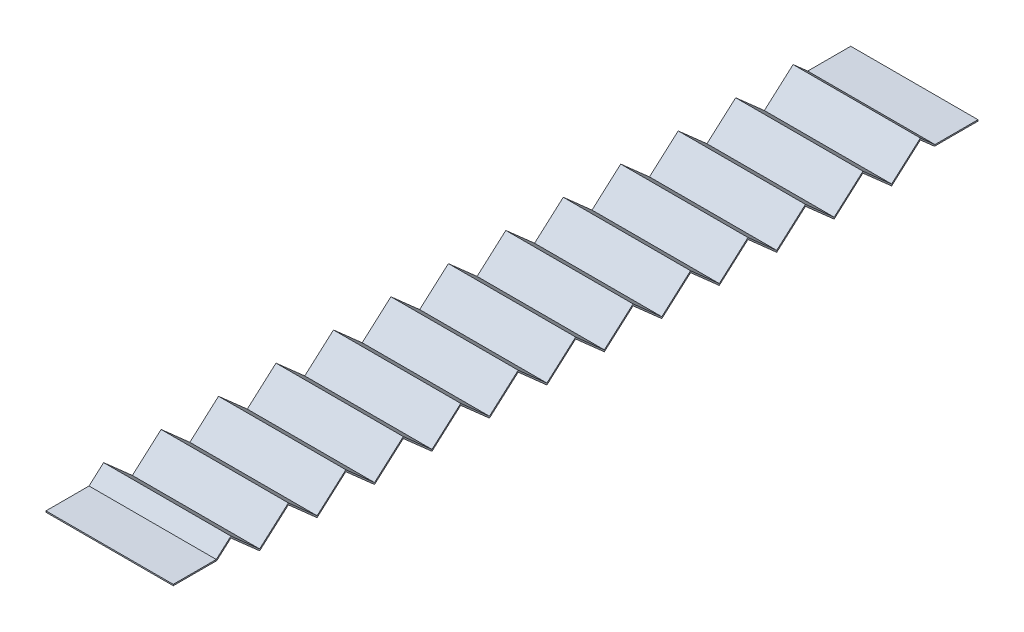
from build123d import *

# Parameters (mm, degrees)
EXTRUDE_THIN1_DEPTH = 25


with BuildPart() as part:
    # Sketch3 → Extrude-Thin1 (new, symmetric)
    with BuildSketch(Plane(origin=(0, 0, 0), x_dir=(0, 0, -1), z_dir=(1, 0, 0))):
        Polygon((0, 4.75), (17.094821022, 4.75), (22.643155114, 9.665985809), (33.929465342, -0.334014191), (45.21577557, 9.665985809), (56.502085798, -0.334014191), (67.788396026, 9.665985809), (79.074706254, -0.334014191), (90.361016482, 9.665985809), (101.64732671, -0.334014191), (112.933636939, 9.665985809), (124.219947167, -0.334014191), (135.506257395, 9.665985809), (146.792567623, -0.334014191), (158.078877851, 9.665985809), (169.365188079, -0.334014191), (180.651498307, 9.665985809), (191.937808535, -0.334014191), (203.224118763, 9.665985809), (214.510428991, -0.334014191), (225.796739219, 9.665985809), (237.083049447, -0.334014191), (248.369359675, 9.665985809), (259.655669903, -0.334014191), (270.941980131, 9.665985809), (282.228290359, -0.334014191), (293.514600587, 9.665985809), (299.062934679, 4.75), (316.157755702, 4.75), (316.157755702, 5.25), (299.252576724, 5.25), (293.514600587, 10.334014191), (282.228290359, 0.334014191), (270.941980131, 10.334014191), (259.655669903, 0.334014191), (248.369359675, 10.334014191), (237.083049447, 0.334014191), (225.796739219, 10.334014191), (214.510428991, 0.334014191), (203.224118763, 10.334014191), (191.937808535, 0.334014191), (180.651498307, 10.334014191), (169.365188079, 0.334014191), (158.078877851, 10.334014191), (146.792567623, 0.334014191), (135.506257395, 10.334014191), (124.219947167, 0.334014191), (112.933636939, 10.334014191), (101.64732671, 0.334014191), (90.361016482, 10.334014191), (79.074706254, 0.334014191), (67.788396026, 10.334014191), (56.502085798, 0.334014191), (45.21577557, 10.334014191), (33.929465342, 0.334014191), (22.643155114, 10.334014191), (16.905178978, 5.25), (0, 5.25), align=None)
    extrude(amount=EXTRUDE_THIN1_DEPTH, both=True)


solid = part.part
